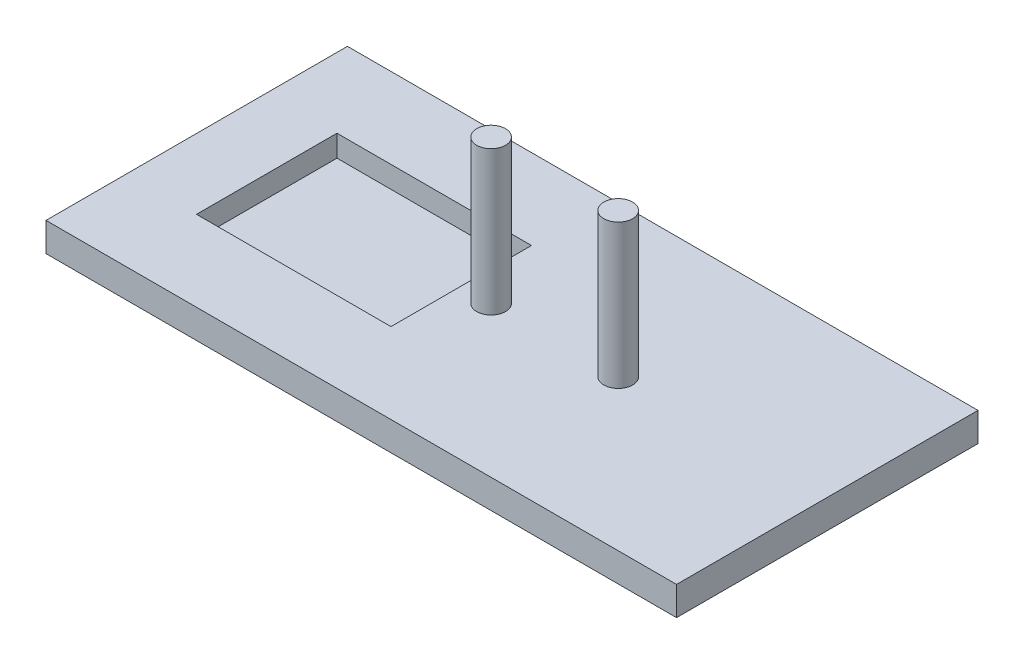
from build123d import *

# Parameters (mm, degrees)
SKETCH2_W           = 87.539995472
SKETCH2_H           = 41.852922876
BOSS_EXTRUDE1_DEPTH = 4
SKETCH2_4_W         = 27
SKETCH2_4_H         = 19.5
CUT_EXTRUDE1_DEPTH  = 3
SKETCH1_R           = 2
BOSS_EXTRUDE2_DEPTH = 20


with BuildPart() as part:
    # Sketch2 → Boss-Extrude1 (new body)
    with BuildSketch(Plane(origin=(0, 0, 0), x_dir=(1, 0, 0), z_dir=(0, 1, 0))):
        Rectangle(SKETCH2_W, SKETCH2_H)
    extrude(amount=-BOSS_EXTRUDE1_DEPTH)

    # Sketch2<4> → Cut-Extrude1 (cut)
    with BuildSketch(Plane(origin=(0, 0, 0), x_dir=(1, 0, 0), z_dir=(0, 1, 0))):
        with Locations((-20.55019048, 0)):
            Rectangle(SKETCH2_4_W, SKETCH2_4_H)
    extrude(amount=-CUT_EXTRUDE1_DEPTH, mode=Mode.SUBTRACT)

    # Sketch1 → Boss-Extrude2 (add)
    with BuildSketch(Plane(origin=(0, 0, 0), x_dir=(1, 0, 0), z_dir=(0, 1, 0))):
        with Locations((14.74940952, 0)):
            Circle(SKETCH1_R)
        with Locations((-2.90039048, 0)):
            Circle(SKETCH1_R)
    extrude(amount=BOSS_EXTRUDE2_DEPTH)


solid = part.part
